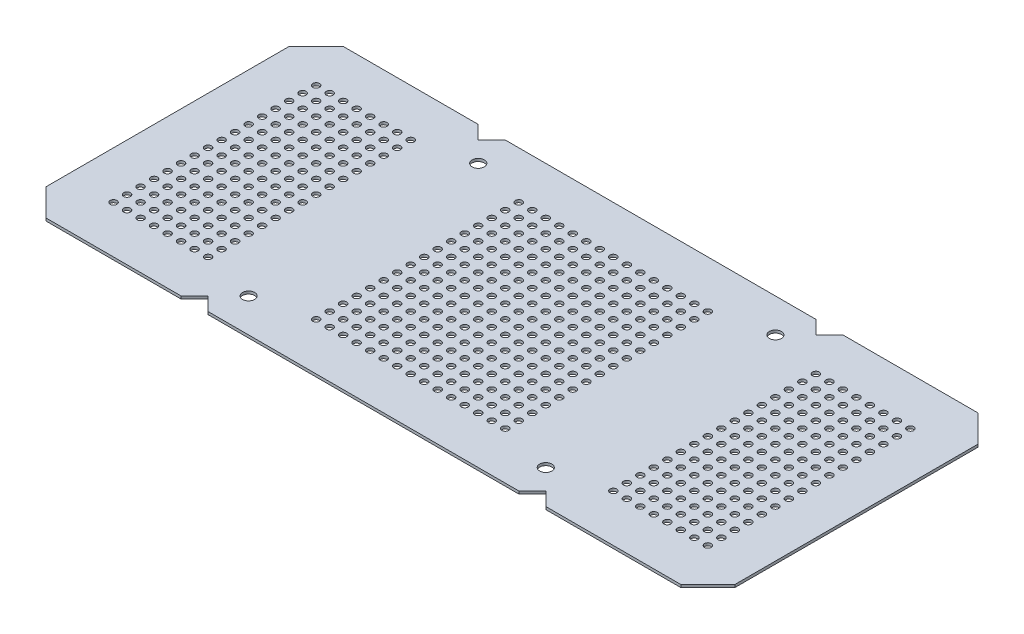
from build123d import *

# Parameters (mm, degrees)
CROQUIS1_R              = 4.5
CROQUIS1_W              = 80
CROQUIS1_H              = 160
CROQUIS1_W_2            = 150
SALIENTE_EXTRUIR1_DEPTH = 2
CROQUIS4_W              = 80
CROQUIS4_H              = 160
CROQUIS4_R              = 2.5
CROQUIS4_W_2            = 150
SALIENTE_EXTRUIR2_DEPTH = 2


with BuildPart() as part:
    # Croquis1 → Saliente-Extruir1 (new body)
    with BuildSketch(Plane(origin=(0, 0, 0), x_dir=(1, 0, 0), z_dir=(0, 1, 0))):
        Polygon((-245, 100), (-235, 110), (-135, 110), (-125, 100), (-115, 110), (115, 110), (125, 100), (135, 110), (235, 110), (245, 100), (255, 90), (255, -90), (245, -100), (235, -110), (135, -110), (125, -100), (115, -110), (-115, -110), (-125, -100), (-135, -110), (-235, -110), (-245, -100), (-255, -90), (-255, 90), align=None)
        with Locations((-110, 85)):
            Circle(CROQUIS1_R, mode=Mode.SUBTRACT)
        with Locations((110, 85)):
            Circle(CROQUIS1_R, mode=Mode.SUBTRACT)
        with Locations((110, -85)):
            Circle(CROQUIS1_R, mode=Mode.SUBTRACT)
        with Locations((-110, -85)):
            Circle(CROQUIS1_R, mode=Mode.SUBTRACT)
        with Locations((-185, 0)):
            Rectangle(CROQUIS1_W, CROQUIS1_H, mode=Mode.SUBTRACT)
        with Locations((185, 0)):
            Rectangle(CROQUIS1_W, CROQUIS1_H, mode=Mode.SUBTRACT)
        Rectangle(CROQUIS1_W_2, CROQUIS1_H, mode=Mode.SUBTRACT)
    extrude(amount=SALIENTE_EXTRUIR1_DEPTH)

    # Croquis4 → Saliente-Extruir2 (add)
    # profile 1 of 3: a face of its own
    with BuildSketch(Plane(origin=(0, 2, 0), x_dir=(1, 0, 0), z_dir=(0, 1, 0))):
        with Locations((-185, 0)):
            Rectangle(CROQUIS4_W, CROQUIS4_H)
        with Locations((-220, 75)):
            Circle(CROQUIS4_R, mode=Mode.SUBTRACT)
        with Locations((-210, 75)):
            Circle(CROQUIS4_R, mode=Mode.SUBTRACT)
        with Locations((-200, 75)):
            Circle(CROQUIS4_R, mode=Mode.SUBTRACT)
        with Locations((-190, 75)):
            Circle(CROQUIS4_R, mode=Mode.SUBTRACT)
        with Locations((-180, 75)):
            Circle(CROQUIS4_R, mode=Mode.SUBTRACT)
        with Locations((-170, 75)):
            Circle(CROQUIS4_R, mode=Mode.SUBTRACT)
        with Locations((-160, 75)):
            Circle(CROQUIS4_R, mode=Mode.SUBTRACT)
        with Locations((-150, 75)):
            Circle(CROQUIS4_R, mode=Mode.SUBTRACT)
        with Locations((-210, 65)):
            Circle(CROQUIS4_R, mode=Mode.SUBTRACT)
        with Locations((-200, 65)):
            Circle(CROQUIS4_R, mode=Mode.SUBTRACT)
        with Locations((-190, 65)):
            Circle(CROQUIS4_R, mode=Mode.SUBTRACT)
        with Locations((-180, 65)):
            Circle(CROQUIS4_R, mode=Mode.SUBTRACT)
        with Locations((-170, 65)):
            Circle(CROQUIS4_R, mode=Mode.SUBTRACT)
        with Locations((-160, 65)):
            Circle(CROQUIS4_R, mode=Mode.SUBTRACT)
        with Locations((-150, 65)):
            Circle(CROQUIS4_R, mode=Mode.SUBTRACT)
        with Locations((-210, 55)):
            Circle(CROQUIS4_R, mode=Mode.SUBTRACT)
        with Locations((-200, 55)):
            Circle(CROQUIS4_R, mode=Mode.SUBTRACT)
        with Locations((-190, 55)):
            Circle(CROQUIS4_R, mode=Mode.SUBTRACT)
        with Locations((-180, 55)):
            Circle(CROQUIS4_R, mode=Mode.SUBTRACT)
        with Locations((-170, 55)):
            Circle(CROQUIS4_R, mode=Mode.SUBTRACT)
        with Locations((-160, 55)):
            Circle(CROQUIS4_R, mode=Mode.SUBTRACT)
        with Locations((-150, 55)):
            Circle(CROQUIS4_R, mode=Mode.SUBTRACT)
        with Locations((-210, 45)):
            Circle(CROQUIS4_R, mode=Mode.SUBTRACT)
        with Locations((-200, 45)):
            Circle(CROQUIS4_R, mode=Mode.SUBTRACT)
        with Locations((-190, 45)):
            Circle(CROQUIS4_R, mode=Mode.SUBTRACT)
        with Locations((-180, 45)):
            Circle(CROQUIS4_R, mode=Mode.SUBTRACT)
        with Locations((-170, 45)):
            Circle(CROQUIS4_R, mode=Mode.SUBTRACT)
        with Locations((-160, 45)):
            Circle(CROQUIS4_R, mode=Mode.SUBTRACT)
        with Locations((-150, 45)):
            Circle(CROQUIS4_R, mode=Mode.SUBTRACT)
        with Locations((-210, 35)):
            Circle(CROQUIS4_R, mode=Mode.SUBTRACT)
        with Locations((-200, 35)):
            Circle(CROQUIS4_R, mode=Mode.SUBTRACT)
        with Locations((-190, 35)):
            Circle(CROQUIS4_R, mode=Mode.SUBTRACT)
        with Locations((-180, 35)):
            Circle(CROQUIS4_R, mode=Mode.SUBTRACT)
        with Locations((-170, 35)):
            Circle(CROQUIS4_R, mode=Mode.SUBTRACT)
        with Locations((-160, 35)):
            Circle(CROQUIS4_R, mode=Mode.SUBTRACT)
        with Locations((-150, 35)):
            Circle(CROQUIS4_R, mode=Mode.SUBTRACT)
        with Locations((-210, 25)):
            Circle(CROQUIS4_R, mode=Mode.SUBTRACT)
        with Locations((-200, 25)):
            Circle(CROQUIS4_R, mode=Mode.SUBTRACT)
        with Locations((-190, 25)):
            Circle(CROQUIS4_R, mode=Mode.SUBTRACT)
        with Locations((-180, 25)):
            Circle(CROQUIS4_R, mode=Mode.SUBTRACT)
        with Locations((-170, 25)):
            Circle(CROQUIS4_R, mode=Mode.SUBTRACT)
        with Locations((-160, 25)):
            Circle(CROQUIS4_R, mode=Mode.SUBTRACT)
        with Locations((-150, 25)):
            Circle(CROQUIS4_R, mode=Mode.SUBTRACT)
        with Locations((-210, 15)):
            Circle(CROQUIS4_R, mode=Mode.SUBTRACT)
        with Locations((-200, 15)):
            Circle(CROQUIS4_R, mode=Mode.SUBTRACT)
        with Locations((-190, 15)):
            Circle(CROQUIS4_R, mode=Mode.SUBTRACT)
        with Locations((-180, 15)):
            Circle(CROQUIS4_R, mode=Mode.SUBTRACT)
        with Locations((-170, 15)):
            Circle(CROQUIS4_R, mode=Mode.SUBTRACT)
        with Locations((-160, 15)):
            Circle(CROQUIS4_R, mode=Mode.SUBTRACT)
        with Locations((-150, 15)):
            Circle(CROQUIS4_R, mode=Mode.SUBTRACT)
        with Locations((-210, 5)):
            Circle(CROQUIS4_R, mode=Mode.SUBTRACT)
        with Locations((-200, 5)):
            Circle(CROQUIS4_R, mode=Mode.SUBTRACT)
        with Locations((-190, 5)):
            Circle(CROQUIS4_R, mode=Mode.SUBTRACT)
        with Locations((-180, 5)):
            Circle(CROQUIS4_R, mode=Mode.SUBTRACT)
        with Locations((-170, 5)):
            Circle(CROQUIS4_R, mode=Mode.SUBTRACT)
        with Locations((-160, 5)):
            Circle(CROQUIS4_R, mode=Mode.SUBTRACT)
        with Locations((-150, 5)):
            Circle(CROQUIS4_R, mode=Mode.SUBTRACT)
        with Locations((-210, -5)):
            Circle(CROQUIS4_R, mode=Mode.SUBTRACT)
        with Locations((-200, -5)):
            Circle(CROQUIS4_R, mode=Mode.SUBTRACT)
        with Locations((-190, -5)):
            Circle(CROQUIS4_R, mode=Mode.SUBTRACT)
        with Locations((-180, -5)):
            Circle(CROQUIS4_R, mode=Mode.SUBTRACT)
        with Locations((-170, -5)):
            Circle(CROQUIS4_R, mode=Mode.SUBTRACT)
        with Locations((-160, -5)):
            Circle(CROQUIS4_R, mode=Mode.SUBTRACT)
        with Locations((-150, -5)):
            Circle(CROQUIS4_R, mode=Mode.SUBTRACT)
        with Locations((-210, -15)):
            Circle(CROQUIS4_R, mode=Mode.SUBTRACT)
        with Locations((-200, -15)):
            Circle(CROQUIS4_R, mode=Mode.SUBTRACT)
        with Locations((-190, -15)):
            Circle(CROQUIS4_R, mode=Mode.SUBTRACT)
        with Locations((-180, -15)):
            Circle(CROQUIS4_R, mode=Mode.SUBTRACT)
        with Locations((-170, -15)):
            Circle(CROQUIS4_R, mode=Mode.SUBTRACT)
        with Locations((-160, -15)):
            Circle(CROQUIS4_R, mode=Mode.SUBTRACT)
        with Locations((-150, -15)):
            Circle(CROQUIS4_R, mode=Mode.SUBTRACT)
        with Locations((-210, -25)):
            Circle(CROQUIS4_R, mode=Mode.SUBTRACT)
        with Locations((-200, -25)):
            Circle(CROQUIS4_R, mode=Mode.SUBTRACT)
        with Locations((-190, -25)):
            Circle(CROQUIS4_R, mode=Mode.SUBTRACT)
        with Locations((-180, -25)):
            Circle(CROQUIS4_R, mode=Mode.SUBTRACT)
        with Locations((-170, -25)):
            Circle(CROQUIS4_R, mode=Mode.SUBTRACT)
        with Locations((-160, -25)):
            Circle(CROQUIS4_R, mode=Mode.SUBTRACT)
        with Locations((-150, -25)):
            Circle(CROQUIS4_R, mode=Mode.SUBTRACT)
        with Locations((-210, -35)):
            Circle(CROQUIS4_R, mode=Mode.SUBTRACT)
        with Locations((-200, -35)):
            Circle(CROQUIS4_R, mode=Mode.SUBTRACT)
        with Locations((-190, -35)):
            Circle(CROQUIS4_R, mode=Mode.SUBTRACT)
        with Locations((-180, -35)):
            Circle(CROQUIS4_R, mode=Mode.SUBTRACT)
        with Locations((-170, -35)):
            Circle(CROQUIS4_R, mode=Mode.SUBTRACT)
        with Locations((-160, -35)):
            Circle(CROQUIS4_R, mode=Mode.SUBTRACT)
        with Locations((-150, -35)):
            Circle(CROQUIS4_R, mode=Mode.SUBTRACT)
        with Locations((-210, -45)):
            Circle(CROQUIS4_R, mode=Mode.SUBTRACT)
        with Locations((-200, -45)):
            Circle(CROQUIS4_R, mode=Mode.SUBTRACT)
        with Locations((-190, -45)):
            Circle(CROQUIS4_R, mode=Mode.SUBTRACT)
        with Locations((-180, -45)):
            Circle(CROQUIS4_R, mode=Mode.SUBTRACT)
        with Locations((-170, -45)):
            Circle(CROQUIS4_R, mode=Mode.SUBTRACT)
        with Locations((-160, -45)):
            Circle(CROQUIS4_R, mode=Mode.SUBTRACT)
        with Locations((-150, -45)):
            Circle(CROQUIS4_R, mode=Mode.SUBTRACT)
        with Locations((-210, -55)):
            Circle(CROQUIS4_R, mode=Mode.SUBTRACT)
        with Locations((-200, -55)):
            Circle(CROQUIS4_R, mode=Mode.SUBTRACT)
        with Locations((-190, -55)):
            Circle(CROQUIS4_R, mode=Mode.SUBTRACT)
        with Locations((-180, -55)):
            Circle(CROQUIS4_R, mode=Mode.SUBTRACT)
        with Locations((-170, -55)):
            Circle(CROQUIS4_R, mode=Mode.SUBTRACT)
        with Locations((-160, -55)):
            Circle(CROQUIS4_R, mode=Mode.SUBTRACT)
        with Locations((-150, -55)):
            Circle(CROQUIS4_R, mode=Mode.SUBTRACT)
        with Locations((-210, -65)):
            Circle(CROQUIS4_R, mode=Mode.SUBTRACT)
        with Locations((-200, -65)):
            Circle(CROQUIS4_R, mode=Mode.SUBTRACT)
        with Locations((-190, -65)):
            Circle(CROQUIS4_R, mode=Mode.SUBTRACT)
        with Locations((-180, -65)):
            Circle(CROQUIS4_R, mode=Mode.SUBTRACT)
        with Locations((-170, -65)):
            Circle(CROQUIS4_R, mode=Mode.SUBTRACT)
        with Locations((-160, -65)):
            Circle(CROQUIS4_R, mode=Mode.SUBTRACT)
        with Locations((-150, -65)):
            Circle(CROQUIS4_R, mode=Mode.SUBTRACT)
        with Locations((-210, -75)):
            Circle(CROQUIS4_R, mode=Mode.SUBTRACT)
        with Locations((-200, -75)):
            Circle(CROQUIS4_R, mode=Mode.SUBTRACT)
        with Locations((-190, -75)):
            Circle(CROQUIS4_R, mode=Mode.SUBTRACT)
        with Locations((-180, -75)):
            Circle(CROQUIS4_R, mode=Mode.SUBTRACT)
        with Locations((-170, -75)):
            Circle(CROQUIS4_R, mode=Mode.SUBTRACT)
        with Locations((-160, -75)):
            Circle(CROQUIS4_R, mode=Mode.SUBTRACT)
        with Locations((-150, -75)):
            Circle(CROQUIS4_R, mode=Mode.SUBTRACT)
        with Locations((-220, 65)):
            Circle(CROQUIS4_R, mode=Mode.SUBTRACT)
        with Locations((-220, 55)):
            Circle(CROQUIS4_R, mode=Mode.SUBTRACT)
        with Locations((-220, 45)):
            Circle(CROQUIS4_R, mode=Mode.SUBTRACT)
        with Locations((-220, 35)):
            Circle(CROQUIS4_R, mode=Mode.SUBTRACT)
        with Locations((-220, 25)):
            Circle(CROQUIS4_R, mode=Mode.SUBTRACT)
        with Locations((-220, 15)):
            Circle(CROQUIS4_R, mode=Mode.SUBTRACT)
        with Locations((-220, 5)):
            Circle(CROQUIS4_R, mode=Mode.SUBTRACT)
        with Locations((-220, -5)):
            Circle(CROQUIS4_R, mode=Mode.SUBTRACT)
        with Locations((-220, -15)):
            Circle(CROQUIS4_R, mode=Mode.SUBTRACT)
        with Locations((-220, -25)):
            Circle(CROQUIS4_R, mode=Mode.SUBTRACT)
        with Locations((-220, -35)):
            Circle(CROQUIS4_R, mode=Mode.SUBTRACT)
        with Locations((-220, -45)):
            Circle(CROQUIS4_R, mode=Mode.SUBTRACT)
        with Locations((-220, -55)):
            Circle(CROQUIS4_R, mode=Mode.SUBTRACT)
        with Locations((-220, -65)):
            Circle(CROQUIS4_R, mode=Mode.SUBTRACT)
        with Locations((-220, -75)):
            Circle(CROQUIS4_R, mode=Mode.SUBTRACT)
    # profile 2 of 3: a face of its own
    with BuildSketch(Plane(origin=(0, 2, 0), x_dir=(1, 0, 0), z_dir=(0, 1, 0))):
        Rectangle(CROQUIS4_W_2, CROQUIS4_H)
        with Locations((-70, 75)):
            Circle(CROQUIS4_R, mode=Mode.SUBTRACT)
        with Locations((-60, 75)):
            Circle(CROQUIS4_R, mode=Mode.SUBTRACT)
        with Locations((-50, 75)):
            Circle(CROQUIS4_R, mode=Mode.SUBTRACT)
        with Locations((-40, 75)):
            Circle(CROQUIS4_R, mode=Mode.SUBTRACT)
        with Locations((-30, 75)):
            Circle(CROQUIS4_R, mode=Mode.SUBTRACT)
        with Locations((-20, 75)):
            Circle(CROQUIS4_R, mode=Mode.SUBTRACT)
        with Locations((-10, 75)):
            Circle(CROQUIS4_R, mode=Mode.SUBTRACT)
        with Locations((0, 75)):
            Circle(CROQUIS4_R, mode=Mode.SUBTRACT)
        with Locations((10, 75)):
            Circle(CROQUIS4_R, mode=Mode.SUBTRACT)
        with Locations((20, 75)):
            Circle(CROQUIS4_R, mode=Mode.SUBTRACT)
        with Locations((30, 75)):
            Circle(CROQUIS4_R, mode=Mode.SUBTRACT)
        with Locations((40, 75)):
            Circle(CROQUIS4_R, mode=Mode.SUBTRACT)
        with Locations((50, 75)):
            Circle(CROQUIS4_R, mode=Mode.SUBTRACT)
        with Locations((60, 75)):
            Circle(CROQUIS4_R, mode=Mode.SUBTRACT)
        with Locations((70, 75)):
            Circle(CROQUIS4_R, mode=Mode.SUBTRACT)
        with Locations((-60, 65)):
            Circle(CROQUIS4_R, mode=Mode.SUBTRACT)
        with Locations((-50, 65)):
            Circle(CROQUIS4_R, mode=Mode.SUBTRACT)
        with Locations((-40, 65)):
            Circle(CROQUIS4_R, mode=Mode.SUBTRACT)
        with Locations((-30, 65)):
            Circle(CROQUIS4_R, mode=Mode.SUBTRACT)
        with Locations((-20, 65)):
            Circle(CROQUIS4_R, mode=Mode.SUBTRACT)
        with Locations((-10, 65)):
            Circle(CROQUIS4_R, mode=Mode.SUBTRACT)
        with Locations((0, 65)):
            Circle(CROQUIS4_R, mode=Mode.SUBTRACT)
        with Locations((10, 65)):
            Circle(CROQUIS4_R, mode=Mode.SUBTRACT)
        with Locations((20, 65)):
            Circle(CROQUIS4_R, mode=Mode.SUBTRACT)
        with Locations((30, 65)):
            Circle(CROQUIS4_R, mode=Mode.SUBTRACT)
        with Locations((40, 65)):
            Circle(CROQUIS4_R, mode=Mode.SUBTRACT)
        with Locations((50, 65)):
            Circle(CROQUIS4_R, mode=Mode.SUBTRACT)
        with Locations((60, 65)):
            Circle(CROQUIS4_R, mode=Mode.SUBTRACT)
        with Locations((70, 65)):
            Circle(CROQUIS4_R, mode=Mode.SUBTRACT)
        with Locations((-60, 55)):
            Circle(CROQUIS4_R, mode=Mode.SUBTRACT)
        with Locations((-50, 55)):
            Circle(CROQUIS4_R, mode=Mode.SUBTRACT)
        with Locations((-40, 55)):
            Circle(CROQUIS4_R, mode=Mode.SUBTRACT)
        with Locations((-30, 55)):
            Circle(CROQUIS4_R, mode=Mode.SUBTRACT)
        with Locations((-20, 55)):
            Circle(CROQUIS4_R, mode=Mode.SUBTRACT)
        with Locations((-10, 55)):
            Circle(CROQUIS4_R, mode=Mode.SUBTRACT)
        with Locations((0, 55)):
            Circle(CROQUIS4_R, mode=Mode.SUBTRACT)
        with Locations((10, 55)):
            Circle(CROQUIS4_R, mode=Mode.SUBTRACT)
        with Locations((20, 55)):
            Circle(CROQUIS4_R, mode=Mode.SUBTRACT)
        with Locations((30, 55)):
            Circle(CROQUIS4_R, mode=Mode.SUBTRACT)
        with Locations((40, 55)):
            Circle(CROQUIS4_R, mode=Mode.SUBTRACT)
        with Locations((50, 55)):
            Circle(CROQUIS4_R, mode=Mode.SUBTRACT)
        with Locations((60, 55)):
            Circle(CROQUIS4_R, mode=Mode.SUBTRACT)
        with Locations((70, 55)):
            Circle(CROQUIS4_R, mode=Mode.SUBTRACT)
        with Locations((-60, 45)):
            Circle(CROQUIS4_R, mode=Mode.SUBTRACT)
        with Locations((-50, 45)):
            Circle(CROQUIS4_R, mode=Mode.SUBTRACT)
        with Locations((-40, 45)):
            Circle(CROQUIS4_R, mode=Mode.SUBTRACT)
        with Locations((-30, 45)):
            Circle(CROQUIS4_R, mode=Mode.SUBTRACT)
        with Locations((-20, 45)):
            Circle(CROQUIS4_R, mode=Mode.SUBTRACT)
        with Locations((-10, 45)):
            Circle(CROQUIS4_R, mode=Mode.SUBTRACT)
        with Locations((0, 45)):
            Circle(CROQUIS4_R, mode=Mode.SUBTRACT)
        with Locations((10, 45)):
            Circle(CROQUIS4_R, mode=Mode.SUBTRACT)
        with Locations((20, 45)):
            Circle(CROQUIS4_R, mode=Mode.SUBTRACT)
        with Locations((30, 45)):
            Circle(CROQUIS4_R, mode=Mode.SUBTRACT)
        with Locations((40, 45)):
            Circle(CROQUIS4_R, mode=Mode.SUBTRACT)
        with Locations((50, 45)):
            Circle(CROQUIS4_R, mode=Mode.SUBTRACT)
        with Locations((60, 45)):
            Circle(CROQUIS4_R, mode=Mode.SUBTRACT)
        with Locations((70, 45)):
            Circle(CROQUIS4_R, mode=Mode.SUBTRACT)
        with Locations((-60, 35)):
            Circle(CROQUIS4_R, mode=Mode.SUBTRACT)
        with Locations((-50, 35)):
            Circle(CROQUIS4_R, mode=Mode.SUBTRACT)
        with Locations((-40, 35)):
            Circle(CROQUIS4_R, mode=Mode.SUBTRACT)
        with Locations((-30, 35)):
            Circle(CROQUIS4_R, mode=Mode.SUBTRACT)
        with Locations((-20, 35)):
            Circle(CROQUIS4_R, mode=Mode.SUBTRACT)
        with Locations((-10, 35)):
            Circle(CROQUIS4_R, mode=Mode.SUBTRACT)
        with Locations((0, 35)):
            Circle(CROQUIS4_R, mode=Mode.SUBTRACT)
        with Locations((10, 35)):
            Circle(CROQUIS4_R, mode=Mode.SUBTRACT)
        with Locations((20, 35)):
            Circle(CROQUIS4_R, mode=Mode.SUBTRACT)
        with Locations((30, 35)):
            Circle(CROQUIS4_R, mode=Mode.SUBTRACT)
        with Locations((40, 35)):
            Circle(CROQUIS4_R, mode=Mode.SUBTRACT)
        with Locations((50, 35)):
            Circle(CROQUIS4_R, mode=Mode.SUBTRACT)
        with Locations((60, 35)):
            Circle(CROQUIS4_R, mode=Mode.SUBTRACT)
        with Locations((70, 35)):
            Circle(CROQUIS4_R, mode=Mode.SUBTRACT)
        with Locations((-60, 25)):
            Circle(CROQUIS4_R, mode=Mode.SUBTRACT)
        with Locations((-50, 25)):
            Circle(CROQUIS4_R, mode=Mode.SUBTRACT)
        with Locations((-40, 25)):
            Circle(CROQUIS4_R, mode=Mode.SUBTRACT)
        with Locations((-30, 25)):
            Circle(CROQUIS4_R, mode=Mode.SUBTRACT)
        with Locations((-20, 25)):
            Circle(CROQUIS4_R, mode=Mode.SUBTRACT)
        with Locations((-10, 25)):
            Circle(CROQUIS4_R, mode=Mode.SUBTRACT)
        with Locations((0, 25)):
            Circle(CROQUIS4_R, mode=Mode.SUBTRACT)
        with Locations((10, 25)):
            Circle(CROQUIS4_R, mode=Mode.SUBTRACT)
        with Locations((20, 25)):
            Circle(CROQUIS4_R, mode=Mode.SUBTRACT)
        with Locations((30, 25)):
            Circle(CROQUIS4_R, mode=Mode.SUBTRACT)
        with Locations((40, 25)):
            Circle(CROQUIS4_R, mode=Mode.SUBTRACT)
        with Locations((50, 25)):
            Circle(CROQUIS4_R, mode=Mode.SUBTRACT)
        with Locations((60, 25)):
            Circle(CROQUIS4_R, mode=Mode.SUBTRACT)
        with Locations((70, 25)):
            Circle(CROQUIS4_R, mode=Mode.SUBTRACT)
        with Locations((-60, 15)):
            Circle(CROQUIS4_R, mode=Mode.SUBTRACT)
        with Locations((-50, 15)):
            Circle(CROQUIS4_R, mode=Mode.SUBTRACT)
        with Locations((-40, 15)):
            Circle(CROQUIS4_R, mode=Mode.SUBTRACT)
        with Locations((-30, 15)):
            Circle(CROQUIS4_R, mode=Mode.SUBTRACT)
        with Locations((-20, 15)):
            Circle(CROQUIS4_R, mode=Mode.SUBTRACT)
        with Locations((-10, 15)):
            Circle(CROQUIS4_R, mode=Mode.SUBTRACT)
        with Locations((0, 15)):
            Circle(CROQUIS4_R, mode=Mode.SUBTRACT)
        with Locations((10, 15)):
            Circle(CROQUIS4_R, mode=Mode.SUBTRACT)
        with Locations((20, 15)):
            Circle(CROQUIS4_R, mode=Mode.SUBTRACT)
        with Locations((30, 15)):
            Circle(CROQUIS4_R, mode=Mode.SUBTRACT)
        with Locations((40, 15)):
            Circle(CROQUIS4_R, mode=Mode.SUBTRACT)
        with Locations((50, 15)):
            Circle(CROQUIS4_R, mode=Mode.SUBTRACT)
        with Locations((60, 15)):
            Circle(CROQUIS4_R, mode=Mode.SUBTRACT)
        with Locations((70, 15)):
            Circle(CROQUIS4_R, mode=Mode.SUBTRACT)
        with Locations((-60, 5)):
            Circle(CROQUIS4_R, mode=Mode.SUBTRACT)
        with Locations((-50, 5)):
            Circle(CROQUIS4_R, mode=Mode.SUBTRACT)
        with Locations((-40, 5)):
            Circle(CROQUIS4_R, mode=Mode.SUBTRACT)
        with Locations((-30, 5)):
            Circle(CROQUIS4_R, mode=Mode.SUBTRACT)
        with Locations((-20, 5)):
            Circle(CROQUIS4_R, mode=Mode.SUBTRACT)
        with Locations((-10, 5)):
            Circle(CROQUIS4_R, mode=Mode.SUBTRACT)
        with Locations((0, 5)):
            Circle(CROQUIS4_R, mode=Mode.SUBTRACT)
        with Locations((10, 5)):
            Circle(CROQUIS4_R, mode=Mode.SUBTRACT)
        with Locations((20, 5)):
            Circle(CROQUIS4_R, mode=Mode.SUBTRACT)
        with Locations((30, 5)):
            Circle(CROQUIS4_R, mode=Mode.SUBTRACT)
        with Locations((40, 5)):
            Circle(CROQUIS4_R, mode=Mode.SUBTRACT)
        with Locations((50, 5)):
            Circle(CROQUIS4_R, mode=Mode.SUBTRACT)
        with Locations((60, 5)):
            Circle(CROQUIS4_R, mode=Mode.SUBTRACT)
        with Locations((70, 5)):
            Circle(CROQUIS4_R, mode=Mode.SUBTRACT)
        with Locations((-60, -5)):
            Circle(CROQUIS4_R, mode=Mode.SUBTRACT)
        with Locations((-50, -5)):
            Circle(CROQUIS4_R, mode=Mode.SUBTRACT)
        with Locations((-40, -5)):
            Circle(CROQUIS4_R, mode=Mode.SUBTRACT)
        with Locations((-30, -5)):
            Circle(CROQUIS4_R, mode=Mode.SUBTRACT)
        with Locations((-20, -5)):
            Circle(CROQUIS4_R, mode=Mode.SUBTRACT)
        with Locations((-10, -5)):
            Circle(CROQUIS4_R, mode=Mode.SUBTRACT)
        with Locations((0, -5)):
            Circle(CROQUIS4_R, mode=Mode.SUBTRACT)
        with Locations((10, -5)):
            Circle(CROQUIS4_R, mode=Mode.SUBTRACT)
        with Locations((20, -5)):
            Circle(CROQUIS4_R, mode=Mode.SUBTRACT)
        with Locations((30, -5)):
            Circle(CROQUIS4_R, mode=Mode.SUBTRACT)
        with Locations((40, -5)):
            Circle(CROQUIS4_R, mode=Mode.SUBTRACT)
        with Locations((50, -5)):
            Circle(CROQUIS4_R, mode=Mode.SUBTRACT)
        with Locations((60, -5)):
            Circle(CROQUIS4_R, mode=Mode.SUBTRACT)
        with Locations((70, -5)):
            Circle(CROQUIS4_R, mode=Mode.SUBTRACT)
        with Locations((-60, -15)):
            Circle(CROQUIS4_R, mode=Mode.SUBTRACT)
        with Locations((-50, -15)):
            Circle(CROQUIS4_R, mode=Mode.SUBTRACT)
        with Locations((-40, -15)):
            Circle(CROQUIS4_R, mode=Mode.SUBTRACT)
        with Locations((-30, -15)):
            Circle(CROQUIS4_R, mode=Mode.SUBTRACT)
        with Locations((-20, -15)):
            Circle(CROQUIS4_R, mode=Mode.SUBTRACT)
        with Locations((-10, -15)):
            Circle(CROQUIS4_R, mode=Mode.SUBTRACT)
        with Locations((0, -15)):
            Circle(CROQUIS4_R, mode=Mode.SUBTRACT)
        with Locations((10, -15)):
            Circle(CROQUIS4_R, mode=Mode.SUBTRACT)
        with Locations((20, -15)):
            Circle(CROQUIS4_R, mode=Mode.SUBTRACT)
        with Locations((30, -15)):
            Circle(CROQUIS4_R, mode=Mode.SUBTRACT)
        with Locations((40, -15)):
            Circle(CROQUIS4_R, mode=Mode.SUBTRACT)
        with Locations((50, -15)):
            Circle(CROQUIS4_R, mode=Mode.SUBTRACT)
        with Locations((60, -15)):
            Circle(CROQUIS4_R, mode=Mode.SUBTRACT)
        with Locations((70, -15)):
            Circle(CROQUIS4_R, mode=Mode.SUBTRACT)
        with Locations((-60, -25)):
            Circle(CROQUIS4_R, mode=Mode.SUBTRACT)
        with Locations((-50, -25)):
            Circle(CROQUIS4_R, mode=Mode.SUBTRACT)
        with Locations((-40, -25)):
            Circle(CROQUIS4_R, mode=Mode.SUBTRACT)
        with Locations((-30, -25)):
            Circle(CROQUIS4_R, mode=Mode.SUBTRACT)
        with Locations((-20, -25)):
            Circle(CROQUIS4_R, mode=Mode.SUBTRACT)
        with Locations((-10, -25)):
            Circle(CROQUIS4_R, mode=Mode.SUBTRACT)
        with Locations((0, -25)):
            Circle(CROQUIS4_R, mode=Mode.SUBTRACT)
        with Locations((10, -25)):
            Circle(CROQUIS4_R, mode=Mode.SUBTRACT)
        with Locations((20, -25)):
            Circle(CROQUIS4_R, mode=Mode.SUBTRACT)
        with Locations((30, -25)):
            Circle(CROQUIS4_R, mode=Mode.SUBTRACT)
        with Locations((40, -25)):
            Circle(CROQUIS4_R, mode=Mode.SUBTRACT)
        with Locations((50, -25)):
            Circle(CROQUIS4_R, mode=Mode.SUBTRACT)
        with Locations((60, -25)):
            Circle(CROQUIS4_R, mode=Mode.SUBTRACT)
        with Locations((70, -25)):
            Circle(CROQUIS4_R, mode=Mode.SUBTRACT)
        with Locations((-60, -35)):
            Circle(CROQUIS4_R, mode=Mode.SUBTRACT)
        with Locations((-50, -35)):
            Circle(CROQUIS4_R, mode=Mode.SUBTRACT)
        with Locations((-40, -35)):
            Circle(CROQUIS4_R, mode=Mode.SUBTRACT)
        with Locations((-30, -35)):
            Circle(CROQUIS4_R, mode=Mode.SUBTRACT)
        with Locations((-20, -35)):
            Circle(CROQUIS4_R, mode=Mode.SUBTRACT)
        with Locations((-10, -35)):
            Circle(CROQUIS4_R, mode=Mode.SUBTRACT)
        with Locations((0, -35)):
            Circle(CROQUIS4_R, mode=Mode.SUBTRACT)
        with Locations((10, -35)):
            Circle(CROQUIS4_R, mode=Mode.SUBTRACT)
        with Locations((20, -35)):
            Circle(CROQUIS4_R, mode=Mode.SUBTRACT)
        with Locations((30, -35)):
            Circle(CROQUIS4_R, mode=Mode.SUBTRACT)
        with Locations((40, -35)):
            Circle(CROQUIS4_R, mode=Mode.SUBTRACT)
        with Locations((50, -35)):
            Circle(CROQUIS4_R, mode=Mode.SUBTRACT)
        with Locations((60, -35)):
            Circle(CROQUIS4_R, mode=Mode.SUBTRACT)
        with Locations((70, -35)):
            Circle(CROQUIS4_R, mode=Mode.SUBTRACT)
        with Locations((-60, -45)):
            Circle(CROQUIS4_R, mode=Mode.SUBTRACT)
        with Locations((-50, -45)):
            Circle(CROQUIS4_R, mode=Mode.SUBTRACT)
        with Locations((-40, -45)):
            Circle(CROQUIS4_R, mode=Mode.SUBTRACT)
        with Locations((-30, -45)):
            Circle(CROQUIS4_R, mode=Mode.SUBTRACT)
        with Locations((-20, -45)):
            Circle(CROQUIS4_R, mode=Mode.SUBTRACT)
        with Locations((-10, -45)):
            Circle(CROQUIS4_R, mode=Mode.SUBTRACT)
        with Locations((0, -45)):
            Circle(CROQUIS4_R, mode=Mode.SUBTRACT)
        with Locations((10, -45)):
            Circle(CROQUIS4_R, mode=Mode.SUBTRACT)
        with Locations((20, -45)):
            Circle(CROQUIS4_R, mode=Mode.SUBTRACT)
        with Locations((30, -45)):
            Circle(CROQUIS4_R, mode=Mode.SUBTRACT)
        with Locations((40, -45)):
            Circle(CROQUIS4_R, mode=Mode.SUBTRACT)
        with Locations((50, -45)):
            Circle(CROQUIS4_R, mode=Mode.SUBTRACT)
        with Locations((60, -45)):
            Circle(CROQUIS4_R, mode=Mode.SUBTRACT)
        with Locations((70, -45)):
            Circle(CROQUIS4_R, mode=Mode.SUBTRACT)
        with Locations((-60, -55)):
            Circle(CROQUIS4_R, mode=Mode.SUBTRACT)
        with Locations((-50, -55)):
            Circle(CROQUIS4_R, mode=Mode.SUBTRACT)
        with Locations((-40, -55)):
            Circle(CROQUIS4_R, mode=Mode.SUBTRACT)
        with Locations((-30, -55)):
            Circle(CROQUIS4_R, mode=Mode.SUBTRACT)
        with Locations((-20, -55)):
            Circle(CROQUIS4_R, mode=Mode.SUBTRACT)
        with Locations((-10, -55)):
            Circle(CROQUIS4_R, mode=Mode.SUBTRACT)
        with Locations((0, -55)):
            Circle(CROQUIS4_R, mode=Mode.SUBTRACT)
        with Locations((10, -55)):
            Circle(CROQUIS4_R, mode=Mode.SUBTRACT)
        with Locations((20, -55)):
            Circle(CROQUIS4_R, mode=Mode.SUBTRACT)
        with Locations((30, -55)):
            Circle(CROQUIS4_R, mode=Mode.SUBTRACT)
        with Locations((40, -55)):
            Circle(CROQUIS4_R, mode=Mode.SUBTRACT)
        with Locations((50, -55)):
            Circle(CROQUIS4_R, mode=Mode.SUBTRACT)
        with Locations((60, -55)):
            Circle(CROQUIS4_R, mode=Mode.SUBTRACT)
        with Locations((70, -55)):
            Circle(CROQUIS4_R, mode=Mode.SUBTRACT)
        with Locations((-60, -65)):
            Circle(CROQUIS4_R, mode=Mode.SUBTRACT)
        with Locations((-50, -65)):
            Circle(CROQUIS4_R, mode=Mode.SUBTRACT)
        with Locations((-40, -65)):
            Circle(CROQUIS4_R, mode=Mode.SUBTRACT)
        with Locations((-30, -65)):
            Circle(CROQUIS4_R, mode=Mode.SUBTRACT)
        with Locations((-20, -65)):
            Circle(CROQUIS4_R, mode=Mode.SUBTRACT)
        with Locations((-10, -65)):
            Circle(CROQUIS4_R, mode=Mode.SUBTRACT)
        with Locations((0, -65)):
            Circle(CROQUIS4_R, mode=Mode.SUBTRACT)
        with Locations((10, -65)):
            Circle(CROQUIS4_R, mode=Mode.SUBTRACT)
        with Locations((20, -65)):
            Circle(CROQUIS4_R, mode=Mode.SUBTRACT)
        with Locations((30, -65)):
            Circle(CROQUIS4_R, mode=Mode.SUBTRACT)
        with Locations((40, -65)):
            Circle(CROQUIS4_R, mode=Mode.SUBTRACT)
        with Locations((50, -65)):
            Circle(CROQUIS4_R, mode=Mode.SUBTRACT)
        with Locations((60, -65)):
            Circle(CROQUIS4_R, mode=Mode.SUBTRACT)
        with Locations((70, -65)):
            Circle(CROQUIS4_R, mode=Mode.SUBTRACT)
        with Locations((-60, -75)):
            Circle(CROQUIS4_R, mode=Mode.SUBTRACT)
        with Locations((-50, -75)):
            Circle(CROQUIS4_R, mode=Mode.SUBTRACT)
        with Locations((-40, -75)):
            Circle(CROQUIS4_R, mode=Mode.SUBTRACT)
        with Locations((-30, -75)):
            Circle(CROQUIS4_R, mode=Mode.SUBTRACT)
        with Locations((-20, -75)):
            Circle(CROQUIS4_R, mode=Mode.SUBTRACT)
        with Locations((-10, -75)):
            Circle(CROQUIS4_R, mode=Mode.SUBTRACT)
        with Locations((0, -75)):
            Circle(CROQUIS4_R, mode=Mode.SUBTRACT)
        with Locations((10, -75)):
            Circle(CROQUIS4_R, mode=Mode.SUBTRACT)
        with Locations((20, -75)):
            Circle(CROQUIS4_R, mode=Mode.SUBTRACT)
        with Locations((30, -75)):
            Circle(CROQUIS4_R, mode=Mode.SUBTRACT)
        with Locations((40, -75)):
            Circle(CROQUIS4_R, mode=Mode.SUBTRACT)
        with Locations((50, -75)):
            Circle(CROQUIS4_R, mode=Mode.SUBTRACT)
        with Locations((60, -75)):
            Circle(CROQUIS4_R, mode=Mode.SUBTRACT)
        with Locations((70, -75)):
            Circle(CROQUIS4_R, mode=Mode.SUBTRACT)
        with Locations((-70, 65)):
            Circle(CROQUIS4_R, mode=Mode.SUBTRACT)
        with Locations((-70, 55)):
            Circle(CROQUIS4_R, mode=Mode.SUBTRACT)
        with Locations((-70, 45)):
            Circle(CROQUIS4_R, mode=Mode.SUBTRACT)
        with Locations((-70, 35)):
            Circle(CROQUIS4_R, mode=Mode.SUBTRACT)
        with Locations((-70, 25)):
            Circle(CROQUIS4_R, mode=Mode.SUBTRACT)
        with Locations((-70, 15)):
            Circle(CROQUIS4_R, mode=Mode.SUBTRACT)
        with Locations((-70, 5)):
            Circle(CROQUIS4_R, mode=Mode.SUBTRACT)
        with Locations((-70, -5)):
            Circle(CROQUIS4_R, mode=Mode.SUBTRACT)
        with Locations((-70, -15)):
            Circle(CROQUIS4_R, mode=Mode.SUBTRACT)
        with Locations((-70, -25)):
            Circle(CROQUIS4_R, mode=Mode.SUBTRACT)
        with Locations((-70, -35)):
            Circle(CROQUIS4_R, mode=Mode.SUBTRACT)
        with Locations((-70, -45)):
            Circle(CROQUIS4_R, mode=Mode.SUBTRACT)
        with Locations((-70, -55)):
            Circle(CROQUIS4_R, mode=Mode.SUBTRACT)
        with Locations((-70, -65)):
            Circle(CROQUIS4_R, mode=Mode.SUBTRACT)
        with Locations((-70, -75)):
            Circle(CROQUIS4_R, mode=Mode.SUBTRACT)
    # profile 3 of 3: a face of its own
    with BuildSketch(Plane(origin=(0, 2, 0), x_dir=(1, 0, 0), z_dir=(0, 1, 0))):
        with Locations((185, 0)):
            Rectangle(CROQUIS4_W, CROQUIS4_H)
        with Locations((150, 75)):
            Circle(CROQUIS4_R, mode=Mode.SUBTRACT)
        with Locations((160, 75)):
            Circle(CROQUIS4_R, mode=Mode.SUBTRACT)
        with Locations((170, 75)):
            Circle(CROQUIS4_R, mode=Mode.SUBTRACT)
        with Locations((180, 75)):
            Circle(CROQUIS4_R, mode=Mode.SUBTRACT)
        with Locations((190, 75)):
            Circle(CROQUIS4_R, mode=Mode.SUBTRACT)
        with Locations((200, 75)):
            Circle(CROQUIS4_R, mode=Mode.SUBTRACT)
        with Locations((210, 75)):
            Circle(CROQUIS4_R, mode=Mode.SUBTRACT)
        with Locations((220, 75)):
            Circle(CROQUIS4_R, mode=Mode.SUBTRACT)
        with Locations((160, 65)):
            Circle(CROQUIS4_R, mode=Mode.SUBTRACT)
        with Locations((170, 65)):
            Circle(CROQUIS4_R, mode=Mode.SUBTRACT)
        with Locations((180, 65)):
            Circle(CROQUIS4_R, mode=Mode.SUBTRACT)
        with Locations((190, 65)):
            Circle(CROQUIS4_R, mode=Mode.SUBTRACT)
        with Locations((200, 65)):
            Circle(CROQUIS4_R, mode=Mode.SUBTRACT)
        with Locations((210, 65)):
            Circle(CROQUIS4_R, mode=Mode.SUBTRACT)
        with Locations((220, 65)):
            Circle(CROQUIS4_R, mode=Mode.SUBTRACT)
        with Locations((160, 55)):
            Circle(CROQUIS4_R, mode=Mode.SUBTRACT)
        with Locations((170, 55)):
            Circle(CROQUIS4_R, mode=Mode.SUBTRACT)
        with Locations((180, 55)):
            Circle(CROQUIS4_R, mode=Mode.SUBTRACT)
        with Locations((190, 55)):
            Circle(CROQUIS4_R, mode=Mode.SUBTRACT)
        with Locations((200, 55)):
            Circle(CROQUIS4_R, mode=Mode.SUBTRACT)
        with Locations((210, 55)):
            Circle(CROQUIS4_R, mode=Mode.SUBTRACT)
        with Locations((220, 55)):
            Circle(CROQUIS4_R, mode=Mode.SUBTRACT)
        with Locations((160, 45)):
            Circle(CROQUIS4_R, mode=Mode.SUBTRACT)
        with Locations((170, 45)):
            Circle(CROQUIS4_R, mode=Mode.SUBTRACT)
        with Locations((180, 45)):
            Circle(CROQUIS4_R, mode=Mode.SUBTRACT)
        with Locations((190, 45)):
            Circle(CROQUIS4_R, mode=Mode.SUBTRACT)
        with Locations((200, 45)):
            Circle(CROQUIS4_R, mode=Mode.SUBTRACT)
        with Locations((210, 45)):
            Circle(CROQUIS4_R, mode=Mode.SUBTRACT)
        with Locations((220, 45)):
            Circle(CROQUIS4_R, mode=Mode.SUBTRACT)
        with Locations((160, 35)):
            Circle(CROQUIS4_R, mode=Mode.SUBTRACT)
        with Locations((170, 35)):
            Circle(CROQUIS4_R, mode=Mode.SUBTRACT)
        with Locations((180, 35)):
            Circle(CROQUIS4_R, mode=Mode.SUBTRACT)
        with Locations((190, 35)):
            Circle(CROQUIS4_R, mode=Mode.SUBTRACT)
        with Locations((200, 35)):
            Circle(CROQUIS4_R, mode=Mode.SUBTRACT)
        with Locations((210, 35)):
            Circle(CROQUIS4_R, mode=Mode.SUBTRACT)
        with Locations((220, 35)):
            Circle(CROQUIS4_R, mode=Mode.SUBTRACT)
        with Locations((160, 25)):
            Circle(CROQUIS4_R, mode=Mode.SUBTRACT)
        with Locations((170, 25)):
            Circle(CROQUIS4_R, mode=Mode.SUBTRACT)
        with Locations((180, 25)):
            Circle(CROQUIS4_R, mode=Mode.SUBTRACT)
        with Locations((190, 25)):
            Circle(CROQUIS4_R, mode=Mode.SUBTRACT)
        with Locations((200, 25)):
            Circle(CROQUIS4_R, mode=Mode.SUBTRACT)
        with Locations((210, 25)):
            Circle(CROQUIS4_R, mode=Mode.SUBTRACT)
        with Locations((220, 25)):
            Circle(CROQUIS4_R, mode=Mode.SUBTRACT)
        with Locations((160, 15)):
            Circle(CROQUIS4_R, mode=Mode.SUBTRACT)
        with Locations((170, 15)):
            Circle(CROQUIS4_R, mode=Mode.SUBTRACT)
        with Locations((180, 15)):
            Circle(CROQUIS4_R, mode=Mode.SUBTRACT)
        with Locations((190, 15)):
            Circle(CROQUIS4_R, mode=Mode.SUBTRACT)
        with Locations((200, 15)):
            Circle(CROQUIS4_R, mode=Mode.SUBTRACT)
        with Locations((210, 15)):
            Circle(CROQUIS4_R, mode=Mode.SUBTRACT)
        with Locations((220, 15)):
            Circle(CROQUIS4_R, mode=Mode.SUBTRACT)
        with Locations((160, 5)):
            Circle(CROQUIS4_R, mode=Mode.SUBTRACT)
        with Locations((170, 5)):
            Circle(CROQUIS4_R, mode=Mode.SUBTRACT)
        with Locations((180, 5)):
            Circle(CROQUIS4_R, mode=Mode.SUBTRACT)
        with Locations((190, 5)):
            Circle(CROQUIS4_R, mode=Mode.SUBTRACT)
        with Locations((200, 5)):
            Circle(CROQUIS4_R, mode=Mode.SUBTRACT)
        with Locations((210, 5)):
            Circle(CROQUIS4_R, mode=Mode.SUBTRACT)
        with Locations((220, 5)):
            Circle(CROQUIS4_R, mode=Mode.SUBTRACT)
        with Locations((160, -5)):
            Circle(CROQUIS4_R, mode=Mode.SUBTRACT)
        with Locations((170, -5)):
            Circle(CROQUIS4_R, mode=Mode.SUBTRACT)
        with Locations((180, -5)):
            Circle(CROQUIS4_R, mode=Mode.SUBTRACT)
        with Locations((190, -5)):
            Circle(CROQUIS4_R, mode=Mode.SUBTRACT)
        with Locations((200, -5)):
            Circle(CROQUIS4_R, mode=Mode.SUBTRACT)
        with Locations((210, -5)):
            Circle(CROQUIS4_R, mode=Mode.SUBTRACT)
        with Locations((220, -5)):
            Circle(CROQUIS4_R, mode=Mode.SUBTRACT)
        with Locations((160, -15)):
            Circle(CROQUIS4_R, mode=Mode.SUBTRACT)
        with Locations((170, -15)):
            Circle(CROQUIS4_R, mode=Mode.SUBTRACT)
        with Locations((180, -15)):
            Circle(CROQUIS4_R, mode=Mode.SUBTRACT)
        with Locations((190, -15)):
            Circle(CROQUIS4_R, mode=Mode.SUBTRACT)
        with Locations((200, -15)):
            Circle(CROQUIS4_R, mode=Mode.SUBTRACT)
        with Locations((210, -15)):
            Circle(CROQUIS4_R, mode=Mode.SUBTRACT)
        with Locations((220, -15)):
            Circle(CROQUIS4_R, mode=Mode.SUBTRACT)
        with Locations((160, -25)):
            Circle(CROQUIS4_R, mode=Mode.SUBTRACT)
        with Locations((170, -25)):
            Circle(CROQUIS4_R, mode=Mode.SUBTRACT)
        with Locations((180, -25)):
            Circle(CROQUIS4_R, mode=Mode.SUBTRACT)
        with Locations((190, -25)):
            Circle(CROQUIS4_R, mode=Mode.SUBTRACT)
        with Locations((200, -25)):
            Circle(CROQUIS4_R, mode=Mode.SUBTRACT)
        with Locations((210, -25)):
            Circle(CROQUIS4_R, mode=Mode.SUBTRACT)
        with Locations((220, -25)):
            Circle(CROQUIS4_R, mode=Mode.SUBTRACT)
        with Locations((160, -35)):
            Circle(CROQUIS4_R, mode=Mode.SUBTRACT)
        with Locations((170, -35)):
            Circle(CROQUIS4_R, mode=Mode.SUBTRACT)
        with Locations((180, -35)):
            Circle(CROQUIS4_R, mode=Mode.SUBTRACT)
        with Locations((190, -35)):
            Circle(CROQUIS4_R, mode=Mode.SUBTRACT)
        with Locations((200, -35)):
            Circle(CROQUIS4_R, mode=Mode.SUBTRACT)
        with Locations((210, -35)):
            Circle(CROQUIS4_R, mode=Mode.SUBTRACT)
        with Locations((220, -35)):
            Circle(CROQUIS4_R, mode=Mode.SUBTRACT)
        with Locations((160, -45)):
            Circle(CROQUIS4_R, mode=Mode.SUBTRACT)
        with Locations((170, -45)):
            Circle(CROQUIS4_R, mode=Mode.SUBTRACT)
        with Locations((180, -45)):
            Circle(CROQUIS4_R, mode=Mode.SUBTRACT)
        with Locations((190, -45)):
            Circle(CROQUIS4_R, mode=Mode.SUBTRACT)
        with Locations((200, -45)):
            Circle(CROQUIS4_R, mode=Mode.SUBTRACT)
        with Locations((210, -45)):
            Circle(CROQUIS4_R, mode=Mode.SUBTRACT)
        with Locations((220, -45)):
            Circle(CROQUIS4_R, mode=Mode.SUBTRACT)
        with Locations((160, -55)):
            Circle(CROQUIS4_R, mode=Mode.SUBTRACT)
        with Locations((170, -55)):
            Circle(CROQUIS4_R, mode=Mode.SUBTRACT)
        with Locations((180, -55)):
            Circle(CROQUIS4_R, mode=Mode.SUBTRACT)
        with Locations((190, -55)):
            Circle(CROQUIS4_R, mode=Mode.SUBTRACT)
        with Locations((200, -55)):
            Circle(CROQUIS4_R, mode=Mode.SUBTRACT)
        with Locations((210, -55)):
            Circle(CROQUIS4_R, mode=Mode.SUBTRACT)
        with Locations((220, -55)):
            Circle(CROQUIS4_R, mode=Mode.SUBTRACT)
        with Locations((160, -65)):
            Circle(CROQUIS4_R, mode=Mode.SUBTRACT)
        with Locations((170, -65)):
            Circle(CROQUIS4_R, mode=Mode.SUBTRACT)
        with Locations((180, -65)):
            Circle(CROQUIS4_R, mode=Mode.SUBTRACT)
        with Locations((190, -65)):
            Circle(CROQUIS4_R, mode=Mode.SUBTRACT)
        with Locations((200, -65)):
            Circle(CROQUIS4_R, mode=Mode.SUBTRACT)
        with Locations((210, -65)):
            Circle(CROQUIS4_R, mode=Mode.SUBTRACT)
        with Locations((220, -65)):
            Circle(CROQUIS4_R, mode=Mode.SUBTRACT)
        with Locations((160, -75)):
            Circle(CROQUIS4_R, mode=Mode.SUBTRACT)
        with Locations((170, -75)):
            Circle(CROQUIS4_R, mode=Mode.SUBTRACT)
        with Locations((180, -75)):
            Circle(CROQUIS4_R, mode=Mode.SUBTRACT)
        with Locations((190, -75)):
            Circle(CROQUIS4_R, mode=Mode.SUBTRACT)
        with Locations((200, -75)):
            Circle(CROQUIS4_R, mode=Mode.SUBTRACT)
        with Locations((210, -75)):
            Circle(CROQUIS4_R, mode=Mode.SUBTRACT)
        with Locations((220, -75)):
            Circle(CROQUIS4_R, mode=Mode.SUBTRACT)
        with Locations((150, 65)):
            Circle(CROQUIS4_R, mode=Mode.SUBTRACT)
        with Locations((150, 55)):
            Circle(CROQUIS4_R, mode=Mode.SUBTRACT)
        with Locations((150, 45)):
            Circle(CROQUIS4_R, mode=Mode.SUBTRACT)
        with Locations((150, 35)):
            Circle(CROQUIS4_R, mode=Mode.SUBTRACT)
        with Locations((150, 25)):
            Circle(CROQUIS4_R, mode=Mode.SUBTRACT)
        with Locations((150, 15)):
            Circle(CROQUIS4_R, mode=Mode.SUBTRACT)
        with Locations((150, 5)):
            Circle(CROQUIS4_R, mode=Mode.SUBTRACT)
        with Locations((150, -5)):
            Circle(CROQUIS4_R, mode=Mode.SUBTRACT)
        with Locations((150, -15)):
            Circle(CROQUIS4_R, mode=Mode.SUBTRACT)
        with Locations((150, -25)):
            Circle(CROQUIS4_R, mode=Mode.SUBTRACT)
        with Locations((150, -35)):
            Circle(CROQUIS4_R, mode=Mode.SUBTRACT)
        with Locations((150, -45)):
            Circle(CROQUIS4_R, mode=Mode.SUBTRACT)
        with Locations((150, -55)):
            Circle(CROQUIS4_R, mode=Mode.SUBTRACT)
        with Locations((150, -65)):
            Circle(CROQUIS4_R, mode=Mode.SUBTRACT)
        with Locations((150, -75)):
            Circle(CROQUIS4_R, mode=Mode.SUBTRACT)
    extrude(amount=-SALIENTE_EXTRUIR2_DEPTH)


solid = part.part
